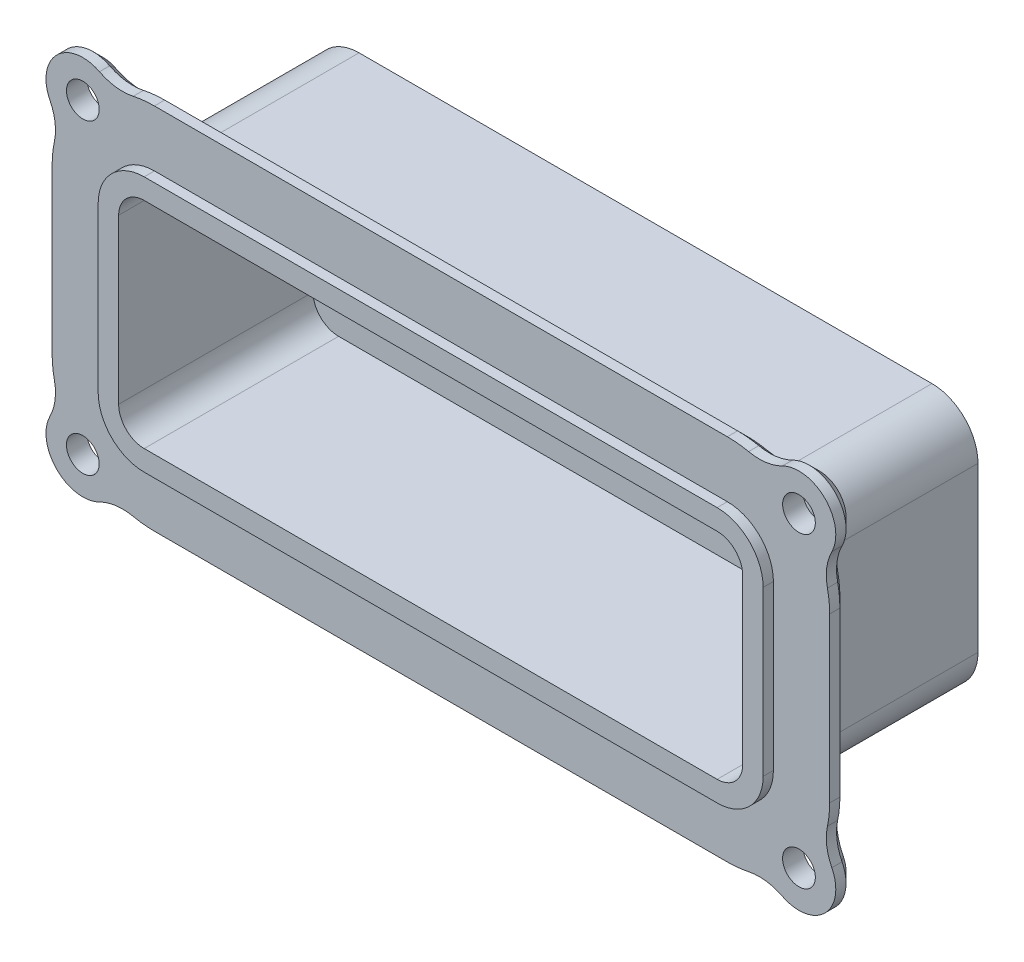
from build123d import *

# Parameters (mm, degrees)
SKETCH1_R                = 1.6
BOSS_EXTRUDE1_DEPTH      = 2
BOSS_EXTRUDE2_DEPTH      = 1
BOSS_EXTRUDE2_DEPTH_BACK = 20
CHAMFER1_SIZE            = 1
SHELL1_START             = -18
SHELL1_DEPTH             = 19
SKETCH2_W                = 3
SKETCH2_H                = 15
CUT_EXTRUDE1_DEPTH       = 48.717082895
FILLET1_R                = 1
LPATTERN1_COUNT          = 11
LPATTERN1_PITCH          = 5
FILLET1_OF_LPATTERN1_R   = 1


# Read off the part's stored shape, not the designer's step: Shell1
with BuildPart() as part:
    # Sketch1 → Boss-Extrude1 (new body)
    with BuildSketch(Plane.XY):
        with BuildLine():
            Line((38, -8), (38, 8))
            ThreePointArc((38, 8), (37.945323743, 9.044287145), (37.781892872, 10.077154747))
            ThreePointArc((37.781892872, 10.077154747), (37.714830787, 11.762378479), (38.211886222, 13.374027399))
            ThreePointArc((38.211886222, 13.374027399), (37.545584412, 17.545584412), (33.374027399, 18.211886222))
            ThreePointArc((33.374027399, 18.211886222), (31.762378479, 17.714830787), (30.077154747, 17.781892872))
            ThreePointArc((30.077154747, 17.781892872), (29.044287145, 17.945323743), (28, 18))
            Line((28, 18), (-28, 18))
            ThreePointArc((-28, 18), (-29.044287145, 17.945323743), (-30.077154747, 17.781892872))
            ThreePointArc((-30.077154747, 17.781892872), (-31.762378479, 17.714830787), (-33.374027399, 18.211886222))
            ThreePointArc((-33.374027399, 18.211886222), (-37.545584412, 17.545584412), (-38.211886222, 13.374027399))
            ThreePointArc((-38.211886222, 13.374027399), (-37.714830787, 11.762378479), (-37.781892872, 10.077154747))
            ThreePointArc((-37.781892872, 10.077154747), (-37.945323743, 9.044287145), (-38, 8))
            Line((-38, 8), (-38, -8))
            ThreePointArc((-38, -8), (-37.945323743, -9.044287145), (-37.781892872, -10.077154747))
            ThreePointArc((-37.781892872, -10.077154747), (-37.714830787, -11.762378479), (-38.211886222, -13.374027399))
            ThreePointArc((-38.211886222, -13.374027399), (-37.545584412, -17.545584412), (-33.374027399, -18.211886222))
            ThreePointArc((-33.374027399, -18.211886222), (-31.762378479, -17.714830787), (-30.077154747, -17.781892872))
            ThreePointArc((-30.077154747, -17.781892872), (-29.044287145, -17.945323743), (-28, -18))
            Line((-28, -18), (28, -18))
            ThreePointArc((28, -18), (29.044287145, -17.945323743), (30.077154747, -17.781892872))
            ThreePointArc((30.077154747, -17.781892872), (31.762378479, -17.714830787), (33.374027399, -18.211886222))
            ThreePointArc((33.374027399, -18.211886222), (37.545584412, -17.545584412), (38.211886222, -13.374027399))
            ThreePointArc((38.211886222, -13.374027399), (37.714830787, -11.762378479), (37.781892872, -10.077154747))
            ThreePointArc((37.781892872, -10.077154747), (37.945323743, -9.044287145), (38, -8))
        make_face()
        with Locations((35, 15)):
            Circle(SKETCH1_R, mode=Mode.SUBTRACT)
        with Locations(Location((-35, 15, 0), (0, 0, 180))):
            Circle(SKETCH1_R, mode=Mode.SUBTRACT)
        with Locations(Location((35, -15, 0), (0, 0, 180))):
            Circle(SKETCH1_R, mode=Mode.SUBTRACT)
        with Locations((-35, -15)):
            Circle(SKETCH1_R, mode=Mode.SUBTRACT)
    extrude(amount=-BOSS_EXTRUDE1_DEPTH)

    # Sketch1<3> → Boss-Extrude2 (add, two sides: drawn at the far end of the back side and taken through both)
    with BuildSketch(Plane.XY.offset(-BOSS_EXTRUDE2_DEPTH_BACK)):
        with BuildLine():
            Line((-28, -12.5), (28, -12.5))
            ThreePointArc((28, -12.5), (31.181980515, -11.181980515), (32.5, -8))
            Line((32.5, -8), (32.5, 8))
            ThreePointArc((32.5, 8), (31.181980515, 11.181980515), (28, 12.5))
            Line((28, 12.5), (-28, 12.5))
            ThreePointArc((-28, 12.5), (-31.181980515, 11.181980515), (-32.5, 8))
            Line((-32.5, 8), (-32.5, -8))
            ThreePointArc((-32.5, -8), (-31.181980515, -11.181980515), (-28, -12.5))
        make_face()
    extrude(amount=BOSS_EXTRUDE2_DEPTH + BOSS_EXTRUDE2_DEPTH_BACK)

    # Chamfer1
    chamfer1_edges = [part.edges().sort_by_distance(p)[0] for p in [
        (-29.044287145, 17.945323743, -2),
        (-31.762378479, 17.714830787, -2),
        (-37.545584412, 17.545584412, -2),
        (-37.714830787, 11.762378479, -2),
        (-37.945323743, 9.044287145, -2),
        (-38, 0, -2),
        (-37.945323743, -9.044287145, -2),
        (-37.714830787, -11.762378479, -2),
        (-37.545584412, -17.545584412, -2),
        (-31.762378479, -17.714830787, -2),
        (29.044287145, 17.945323743, -2),
        (-29.044287145, -17.945323743, -2),
        (0, -18, -2),
        (29.044287145, -17.945323743, -2),
        (31.762378479, -17.714830787, -2),
        (37.545584412, -17.545584412, -2),
        (37.714830787, -11.762378479, -2),
        (37.945323743, -9.044287145, -2),
        (38, 0, -2),
        (37.945323743, 9.044287145, -2),
        (37.714830787, 11.762378479, -2),
        (0, 18, -2),
        (37.545584412, 17.545584412, -2),
        (31.762378479, 17.714830787, -2),
    ]]
    chamfer(chamfer1_edges, length=CHAMFER1_SIZE)

    # Shell1 outline → Shell1 (cut)
    with BuildSketch(Plane.XY.offset(SHELL1_START)):
        with BuildLine():
            Line((-28, -10.5), (28, -10.5))
            ThreePointArc((28, -10.5), (29.767766953, -9.767766953), (30.5, -8))
            Line((30.5, -8), (30.5, 8))
            ThreePointArc((30.5, 8), (29.767766953, 9.767766953), (28, 10.5))
            Line((28, 10.5), (-28, 10.5))
            ThreePointArc((-28, 10.5), (-29.767766953, 9.767766953), (-30.5, 8))
            Line((-30.5, 8), (-30.5, -8))
            ThreePointArc((-30.5, -8), (-29.767766953, -9.767766953), (-28, -10.5))
        make_face()
    extrude(amount=SHELL1_DEPTH, mode=Mode.SUBTRACT)

    # Sketch2 → Cut-Extrude1 (cut, through all)
    with BuildSketch(Plane(origin=(0, 0, -20), x_dir=(-1, 0, 0), z_dir=(0, 0, -1))):
        with Locations((-25, 0)):
            Rectangle(SKETCH2_W, SKETCH2_H)
    cut_extrude1 = extrude(amount=-CUT_EXTRUDE1_DEPTH, mode=Mode.SUBTRACT)

    # Fillet1
    fillet1_edges = [part.edges().sort_by_distance(p)[0] for p in [
        (23.5, 7.5, -19),
        (23.5, -7.5, -19),
        (26.5, -7.5, -19),
        (26.5, 7.5, -19),
    ]]
    fillet(fillet1_edges, radius=FILLET1_R)

    # LPattern1: Cut-Extrude1 ×11
    with Locations(*[(-i * LPATTERN1_PITCH, 0, 0) for i in range(1, LPATTERN1_COUNT)]):
        add(cut_extrude1, mode=Mode.SUBTRACT)

    # Fillet1 of LPattern1
    fillet1_of_lpattern1_edges = [part.edges().sort_by_distance(p)[0] for p in [
        (18.5, 7.5, -19),
        (18.5, -7.5, -19),
        (21.5, -7.5, -19),
        (21.5, 7.5, -19),
        (13.5, 7.5, -19),
        (13.5, -7.5, -19),
        (16.5, -7.5, -19),
        (16.5, 7.5, -19),
        (8.5, 7.5, -19),
        (8.5, -7.5, -19),
        (11.5, -7.5, -19),
        (11.5, 7.5, -19),
        (3.5, 7.5, -19),
        (3.5, -7.5, -19),
        (6.5, -7.5, -19),
        (6.5, 7.5, -19),
        (-1.5, 7.5, -19),
        (-1.5, -7.5, -19),
        (1.5, -7.5, -19),
        (1.5, 7.5, -19),
        (-6.5, 7.5, -19),
        (-6.5, -7.5, -19),
        (-3.5, -7.5, -19),
        (-3.5, 7.5, -19),
        (-11.5, 7.5, -19),
        (-11.5, -7.5, -19),
        (-8.5, -7.5, -19),
        (-8.5, 7.5, -19),
        (-16.5, 7.5, -19),
        (-16.5, -7.5, -19),
        (-13.5, -7.5, -19),
        (-13.5, 7.5, -19),
        (-21.5, 7.5, -19),
        (-21.5, -7.5, -19),
        (-18.5, -7.5, -19),
        (-18.5, 7.5, -19),
        (-26.5, 7.5, -19),
        (-26.5, -7.5, -19),
        (-23.5, -7.5, -19),
        (-23.5, 7.5, -19),
    ]]
    fillet(fillet1_of_lpattern1_edges, radius=FILLET1_OF_LPATTERN1_R)


solid = part.part
